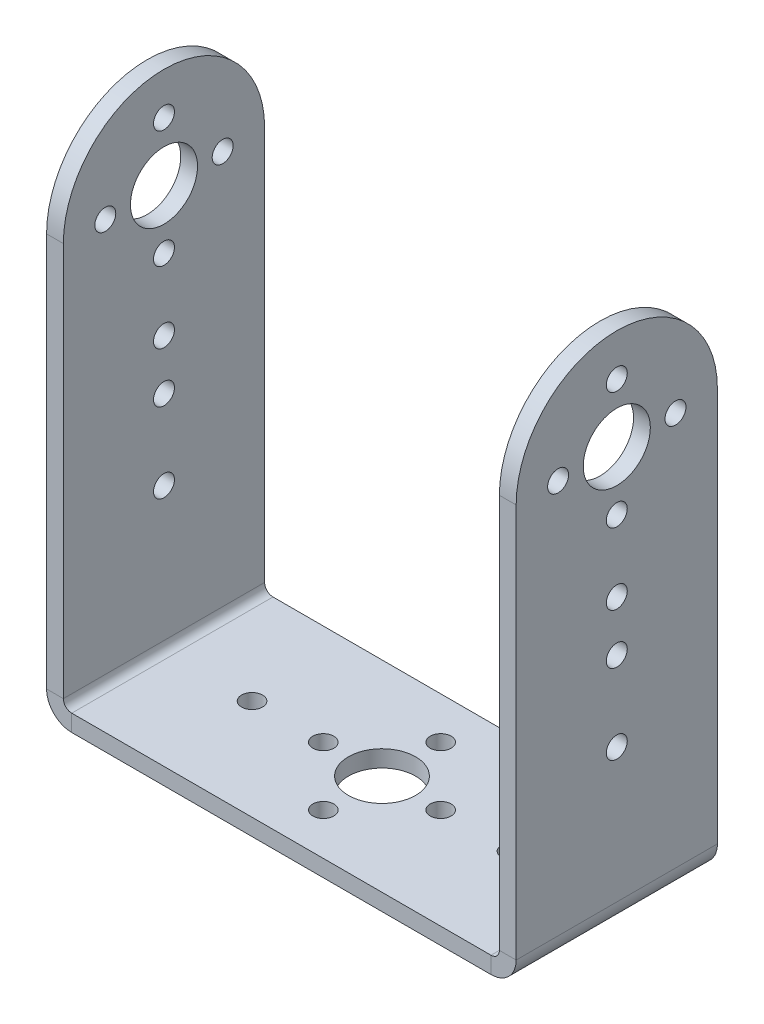
from build123d import *

# Parameters (mm, degrees)
T_LE_DE_BASE_PLI_E1_DEPTH       = 12
ENL_V_START                     = -56
ENL_V_MAT_EXTRU_1_DEPTH         = 56
DIAM_TRE_DU_PER_AGE_8_0_8_1_D   = 8
DIAM_TRE_DU_PER_AGE_2_5_2_5_1_D = 2.5
DIAM_TRE_DU_PER_AGE_8_0_8_2_D   = 8
DIAM_TRE_DU_PER_AGE_2_5_2_5_2_D = 2.5


# Read off the part's stored shape, not the designer's step: Enlèv. mat.-Extru.1
# Sheet-metal steps are written as plain solids
with BuildPart() as part:
    # Esquisse1 → Tôle de base pliée1 (new, symmetric)
    with BuildSketch(Plane.XY):
        with BuildLine():
            Line((-28, 62), (-28, 3))
            ThreePointArc((-28, 3), (-27.121320344, 0.878679656), (-25, 0))
            Line((-25, 0), (25, 0))
            ThreePointArc((25, 0), (27.121320344, 0.878679656), (28, 3))
            Line((28, 3), (28, 62))
            Line((28, 62), (26, 62))
            Line((26, 62), (26, 3))
            ThreePointArc((26, 3), (25.707106781, 2.292893219), (25, 2))
            Line((25, 2), (-25, 2))
            ThreePointArc((-25, 2), (-25.707106781, 2.292893219), (-26, 3))
            Line((-26, 3), (-26, 62))
            Line((-26, 62), (-28, 62))
        make_face()
    extrude(amount=T_LE_DE_BASE_PLI_E1_DEPTH, both=True)

    # Enlèv. mat.-Extru.1 outline → Enlèv. mat.-Extru.1 (cut)
    with BuildSketch(Plane(origin=(28, 0, 0), x_dir=(0, 0, -1), z_dir=(1, 0, 0)).offset(ENL_V_START)):
        with BuildLine():
            ThreePointArc((-12, 50), (-8.485281374, 58.485281374), (0, 62))
            Line((0, 62), (-12, 62))
            Line((-12, 62), (-12, 50))
        make_face()
        with BuildLine():
            ThreePointArc((0, 62), (8.485281374, 58.485281374), (12, 50))
            Line((12, 50), (12, 62))
            Line((12, 62), (0, 62))
        make_face()
    extrude(amount=ENL_V_MAT_EXTRU_1_DEPTH, mode=Mode.SUBTRACT)

    # Diamètre du perçage Ø8.0 (8)1 (through all)
    with Locations(Plane(origin=(28, 0, 0), x_dir=(0, 0, -1), z_dir=(1, 0, 0))):
        with Locations((0, 50)):
            Hole(DIAM_TRE_DU_PER_AGE_8_0_8_1_D / 2)

    # Diamètre du perçage Ø2.5 (2.5)1 (through all)
    with Locations(Plane(origin=(28, 0, 0), x_dir=(0, 0, -1), z_dir=(1, 0, 0))):
        with Locations((0, 57), (7, 50), (0, 43), (-7, 50), (0, 34.5), (0, 28.5), (0, 19)):
            Hole(DIAM_TRE_DU_PER_AGE_2_5_2_5_1_D / 2)

    # Diamètre du perçage Ø8.0 (8)2 (through all)
    with Locations(Plane(origin=(0, 2, 0), x_dir=(1, 0, 0), z_dir=(0, 1, 0))):
        with Locations((0, 0)):
            Hole(DIAM_TRE_DU_PER_AGE_8_0_8_2_D / 2)

    # Diamètre du perçage Ø2.5 (2.5)2 (through all)
    with Locations(Plane(origin=(0, 2, 0), x_dir=(1, 0, 0), z_dir=(0, 1, 0))):
        with Locations((0, 7), (7, 0), (0, -7), (-7, 0), (-15.5, 0), (15.5, 0)):
            Hole(DIAM_TRE_DU_PER_AGE_2_5_2_5_2_D / 2)


solid = part.part
